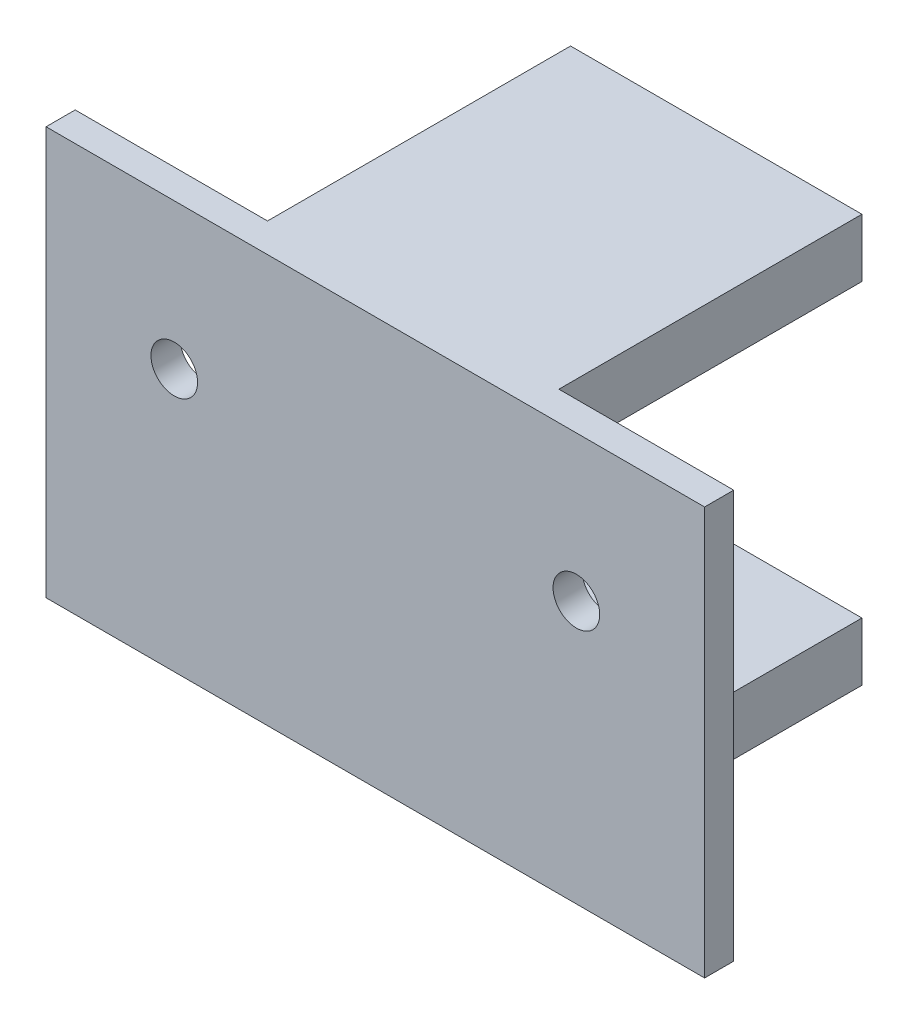
from build123d import *

# Parameters (mm, degrees)
SKETCH_1_W          = 113
SKETCH_1_H          = 70
EXTRUDE_1_DEPTH     = 5
SKETCH_2_W          = 50
SKETCH_2_H          = 10
EXTRUDE_2_DEPTH     = 52
SKETCH_3_R          = 4
CUT_EXTRUDE_1_DEPTH = 85.387499074


with BuildPart() as part:
    # 草图1 → 凸台-拉伸1 (new body)
    with BuildSketch(Plane.XY):
        Rectangle(SKETCH_1_W, SKETCH_1_H)
    extrude(amount=EXTRUDE_1_DEPTH)

    # 草图2 → 凸台-拉伸2 (add)
    with BuildSketch(Plane(origin=(0, 0, 0), x_dir=(-1, 0, 0), z_dir=(0, 0, -1))):
        with Locations((-1.5, -30)):
            Rectangle(SKETCH_2_W, SKETCH_2_H)
        with Locations((-1.5, 30)):
            Rectangle(SKETCH_2_W, SKETCH_2_H)
    extrude(amount=EXTRUDE_2_DEPTH)

    # 草图3 → 切除-拉伸1 (cut, through all)
    with BuildSketch(Plane(origin=(0, 0, 0), x_dir=(-1, 0, 0), z_dir=(0, 0, -1))):
        with Locations((-34.5, 10)):
            Circle(SKETCH_3_R)
        with Locations((34.5, 10)):
            Circle(SKETCH_3_R)
    extrude(amount=-CUT_EXTRUDE_1_DEPTH, mode=Mode.SUBTRACT)


solid = part.part
